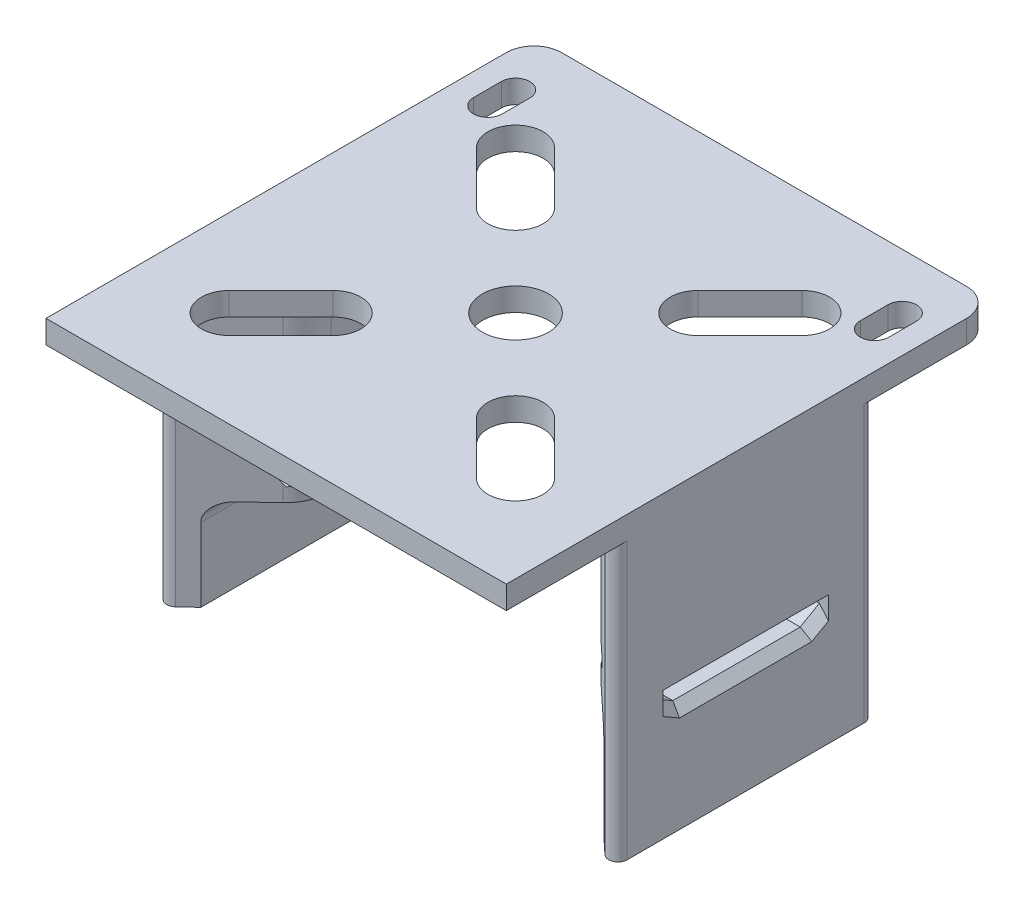
from build123d import *
from OCP.BRepFilletAPI import BRepFilletAPI_MakeChamfer

# Parameters (mm, degrees)
DODANIE_WYCI_GNI_CIE2_DEPTH = 2.5
SZKIC6_R                    = 3.6
WYTNIJ_WYCI_GNI_CIE3_DEPTH  = 37.881567212
DODANIE_WYCI_GNI_CIE3_DEPTH = 20
DODANIE_WYCI_GNI_CIE4_DEPTH = 10
ZAOKR_GLENIE1_R             = 1
ZAOKR_GLENIE2_R             = 5
WYTNIJ_WYCI_GNI_CIE1_REACH  = 59.319
SZKIC3_W                    = 18
SZKIC3_H                    = 2.5
SFAZOWANIE1_SIZE            = 1.2
SFAZOWANIE1_SIZE2           = 2.078460969
ZAOKR_GLENIE4_R             = 2
LUSTRO1_START               = -16
LUSTRO1_DEPTH               = 16
LUSTRO1_START_2             = -30
LUSTRO1_2_DEPTH             = 13.578460969
LUSTRO1_START_3             = -22
LUSTRO1_3_DEPTH             = 5.578460969
LUSTRO1_START_4             = -18.183542828
LUSTRO1_4_DEPTH             = 2.183542828
LUSTRO1_START_5             = -12.281593534
LUSTRO1_5_DEPTH             = 24.563187068
LUSTRO1_START_6             = -26
LUSTRO1_6_DEPTH             = 10.3
WYTNIJ_WYCI_GNI_CIE2_REACH  = 51.094
SFAZOWANIE2_SIZE            = 1
ZAOKR_GLENIE3_R             = 3


with BuildPart() as part:
    # Szkic1 → Dodanie-wyciągnięcie2 (new body)
    with BuildSketch(Plane(origin=(0, 0, 0), x_dir=(1, 0, 0), z_dir=(0, 1, 0))):
        Polygon((-25, -11), (-25, -26), (25, -26), (25, -11), (25, 27), (-25, 27), align=None)
    extrude(amount=DODANIE_WYCI_GNI_CIE2_DEPTH)

    # Szkic6 → Wytnij-wyciągnięcie3 (cut, through all)
    with BuildSketch(Plane(origin=(0, 2.5, 0), x_dir=(1, 0, 0), z_dir=(0, 1, 0))):
        with Locations(Location((0, 0, 0), (0, 0, 270))):
            Circle(SZKIC6_R)
        with BuildLine():
            Line((7.778174593, 12.02081528), (13.435028843, 17.67766953))
            ThreePointArc((13.435028843, 17.67766953), (17.67766953, 17.67766953), (17.67766953, 13.435028843))
            Line((17.67766953, 13.435028843), (12.02081528, 7.778174593))
            ThreePointArc((12.02081528, 7.778174593), (7.778174593, 7.778174593), (7.778174593, 12.02081528))
        make_face()
        with BuildLine():
            Line((12.02081528, -7.778174593), (17.67766953, -13.435028843))
            ThreePointArc((17.67766953, -13.435028843), (17.67766953, -17.67766953), (13.435028843, -17.67766953))
            Line((13.435028843, -17.67766953), (7.778174593, -12.02081528))
            ThreePointArc((7.778174593, -12.02081528), (7.778174593, -7.778174593), (12.02081528, -7.778174593))
        make_face()
        with BuildLine():
            Line((-7.778174593, -12.02081528), (-13.435028843, -17.67766953))
            ThreePointArc((-13.435028843, -17.67766953), (-17.67766953, -17.67766953), (-17.67766953, -13.435028843))
            Line((-17.67766953, -13.435028843), (-12.02081528, -7.778174593))
            ThreePointArc((-12.02081528, -7.778174593), (-7.778174593, -7.778174593), (-7.778174593, -12.02081528))
        make_face()
        with BuildLine():
            Line((-12.02081528, 7.778174593), (-17.67766953, 13.435028843))
            ThreePointArc((-17.67766953, 13.435028843), (-17.67766953, 17.67766953), (-13.435028843, 17.67766953))
            Line((-13.435028843, 17.67766953), (-7.778174593, 12.02081528))
            ThreePointArc((-7.778174593, 12.02081528), (-7.778174593, 7.778174593), (-12.02081528, 7.778174593))
        make_face()
    extrude(amount=-WYTNIJ_WYCI_GNI_CIE3_DEPTH, mode=Mode.SUBTRACT)

    # Szkic2 → Dodanie-wyciągnięcie3 (add)
    with BuildSketch(Plane.XZ):
        Polygon((15.7, -6.5), (15.7, 6.5), (25, 15.172390301), (25, -15.172390301), align=None)
    extrude(amount=DODANIE_WYCI_GNI_CIE3_DEPTH)

    # Szkic8 → Dodanie-wyciągnięcie4 (add)
    with BuildSketch(Plane.XZ.offset(20)):
        Polygon((25, 15.172390301), (25, -15.172390301), (21.9, -12.281593534), (21.9, 12.281593534), align=None)
    extrude(amount=DODANIE_WYCI_GNI_CIE4_DEPTH)

    # Zaokrąglenie1
    zaokr_glenie1_edges = [part.edges().sort_by_distance(p)[0] for p in [
        (25, -15, 15.172390301),
        (25, -15, -15.172390301),
    ]]
    fillet(zaokr_glenie1_edges, radius=ZAOKR_GLENIE1_R)

    # Zaokrąglenie2
    zaokr_glenie2_edges = [part.edges().sort_by_distance(p)[0] for p in [
        (15.7, -10, 6.5),
        (15.7, -10, -6.5),
    ]]
    fillet(zaokr_glenie2_edges, radius=ZAOKR_GLENIE2_R)

    # Szkic3 → Wytnij-wyciągnięcie1 (cut, up to next)
    with BuildSketch(Plane.ZY.offset(-15.7), mode=Mode.PRIVATE) as wytnij_wyci_gni_cie1_sk1:
        with Locations((0, -17.25)):
            Rectangle(SZKIC3_W, SZKIC3_H)
    wytnij_wyci_gni_cie1_tool1 = extrude(wytnij_wyci_gni_cie1_sk1.sketch, amount=-WYTNIJ_WYCI_GNI_CIE1_REACH, mode=Mode.PRIVATE) & part.part
    add(wytnij_wyci_gni_cie1_tool1.solids().sort_by_distance((15.7, -17.25, 0))[0], mode=Mode.SUBTRACT)

    # Sfazowanie1: one chamfer whose edges measure the first distance from different faces: ONE call of the kernel's chamfer builder (chamfer() names one face for all edges)
    sfazowanie1_edges_1 = [part.edges().sort_by_distance(p)[0] for p in [
        (21.690460888, -18.5, -9),
    ]]
    sfazowanie1_side_1 = [part.faces().sort_by_distance(p)[0] for p in [
        (21.690460888, -17.25, -9),
    ]]
    sfazowanie1_edges_2 = [part.edges().sort_by_distance(p)[0] for p in [
        (21.690460888, -18.5, 9),
    ]]
    sfazowanie1_side_2 = [part.faces().sort_by_distance(p)[0] for p in [
        (21.690460888, -17.25, 9),
    ]]
    sfazowanie1 = BRepFilletAPI_MakeChamfer(part.part.solid().wrapped)
    for e in sfazowanie1_edges_1:
        sfazowanie1.Add(SFAZOWANIE1_SIZE, SFAZOWANIE1_SIZE2, e.wrapped, sfazowanie1_side_1[0].wrapped)  # the first distance lies on this face
    for e in sfazowanie1_edges_2:
        sfazowanie1.Add(SFAZOWANIE1_SIZE, SFAZOWANIE1_SIZE2, e.wrapped, sfazowanie1_side_2[0].wrapped)  # the first distance lies on this face
    add(Compound.cast(sfazowanie1.Shape()), mode=Mode.REPLACE)

    # Zaokrąglenie4
    zaokr_glenie4_edges = [part.edges().sort_by_distance(p)[0] for p in [
        (21.9, -20, 0),
    ]]
    fillet(zaokr_glenie4_edges, radius=ZAOKR_GLENIE4_R)

    # Lustro1: read off the stored shape, not the designer's step
    # Lustro1 outline → Lustro1 (add)
    with BuildSketch(Plane(origin=(0, 0, 0), x_dir=(1, 0, 0), z_dir=(0, 1, 0)).offset(LUSTRO1_START)):
        with BuildLine():
            ThreePointArc((-25, -12.872547754), (-24.398749069, -13.789607828), (-23.31800164, -13.603901455))
            Line((-23.31800164, -13.603901455), (-17.2900082, -7.982706633))
            ThreePointArc((-17.2900082, -7.982706633), (-16.114699628, -6.31968347), (-15.7, -4.325938125))
            Line((-15.7, -4.325938125), (-15.7, 4.325938125))
            ThreePointArc((-15.7, 4.325938125), (-16.114699628, 6.31968347), (-17.2900082, 7.982706633))
            Line((-17.2900082, 7.982706633), (-23.31800164, 13.603901455))
            ThreePointArc((-23.31800164, 13.603901455), (-24.398749069, 13.789607828), (-25, 12.872547754))
            Line((-25, 12.872547754), (-25, -12.872547754))
        make_face()
    extrude(amount=LUSTRO1_DEPTH)



with BuildPart() as body_2:
    # Lustro1 2 outline → Lustro1 2 (new body)
    with BuildSketch(Plane(origin=(0, 0, 0), x_dir=(1, 0, 0), z_dir=(0, 1, 0)).offset(LUSTRO1_START_2)):
        with BuildLine():
            ThreePointArc((-25, -12.872547754), (-24.398749069, -13.789607828), (-23.31800164, -13.603901455))
            Line((-23.31800164, -13.603901455), (-21.9, -12.281593534))
            Line((-21.9, -12.281593534), (-21.9, 12.281593534))
            Line((-21.9, 12.281593534), (-23.31800164, 13.603901455))
            ThreePointArc((-23.31800164, 13.603901455), (-24.398749069, 13.789607828), (-25, 12.872547754))
            Line((-25, 12.872547754), (-25, -12.872547754))
        make_face()
    extrude(amount=LUSTRO1_2_DEPTH)

    # Lustro1 3 outline → Lustro1 3 (add)
    with BuildSketch(Plane(origin=(0, 0, 0), x_dir=(1, 0, 0), z_dir=(0, 1, 0)).offset(LUSTRO1_START_3)):
        with BuildLine():
            Line((-21.9, -12.281593534), (-17.2900082, -7.982706633))
            ThreePointArc((-17.2900082, -7.982706633), (-16.114699628, -6.31968347), (-15.7, -4.325938125))
            Line((-15.7, -4.325938125), (-15.7, 4.325938125))
            ThreePointArc((-15.7, 4.325938125), (-16.114699628, 6.31968347), (-17.2900082, 7.982706633))
            Line((-17.2900082, 7.982706633), (-21.9, 12.281593534))
            Line((-21.9, 12.281593534), (-21.9, -12.281593534))
        make_face()
    extrude(amount=LUSTRO1_3_DEPTH)


with BuildPart() as part_1:
    add(part.part)

    add(body_2.part)  # Lustro1 4 merges body 2
    # Lustro1 4 outline → Lustro1 4 (add)
    with BuildSketch(Plane(origin=(0, 0, 0), x_dir=(1, 0, 0), z_dir=(0, 1, 0)).offset(LUSTRO1_START_4)):
        with BuildLine():
            Line((-25, -9), (-25, -12.872547754))
            ThreePointArc((-25, -12.872547754), (-24.398749069, -13.789607828), (-23.31800164, -13.603901455))
            Line((-23.31800164, -13.603901455), (-18.380921775, -9))
            Line((-18.380921775, -9), (-25, -9))
        make_face()
        with BuildLine():
            Line((-25, 12.872547754), (-25, 9))
            Line((-25, 9), (-18.380921775, 9))
            Line((-18.380921775, 9), (-23.31800164, 13.603901455))
            ThreePointArc((-23.31800164, 13.603901455), (-24.398749069, 13.789607828), (-25, 12.872547754))
        make_face()
    extrude(amount=LUSTRO1_4_DEPTH)

    # Lustro1 5 outline → Lustro1 5 (cut)
    with BuildSketch(Plane.XY.offset(LUSTRO1_START_5)):
        with BuildLine():
            Line((-15.7, -22), (-15.7, -20))
            Line((-15.7, -20), (-19.9, -20))
            ThreePointArc((-19.9, -20), (-21.314213562, -20.585786438), (-21.9, -22))
            Line((-21.9, -22), (-15.7, -22))
        make_face()
    extrude(amount=LUSTRO1_5_DEPTH, mode=Mode.SUBTRACT)

    # Lustro1 6 outline → Lustro1 6 (cut)
    with BuildSketch(Plane.YZ.offset(LUSTRO1_START_6)):
        Polygon((-18.5, 7.8), (-18.5, -7.8), (-16.421539031, -9), (-16.421539031, 9), align=None)
    extrude(amount=LUSTRO1_6_DEPTH, mode=Mode.SUBTRACT)

    # Szkic5 → Wytnij-wyciągnięcie2 (cut, up to next)
    with BuildSketch(Plane(origin=(0, 2.5, 0), x_dir=(1, 0, 0), z_dir=(0, 1, 0)), mode=Mode.PRIVATE) as wytnij_wyci_gni_cie2_sk1:
        with BuildLine():
            Line((22.55, 21), (22.55, 18))
            ThreePointArc((22.55, 18), (21, 16.45), (19.45, 18))
            Line((19.45, 18), (19.45, 21))
            ThreePointArc((19.45, 21), (21, 22.55), (22.55, 21))
        make_face()
    wytnij_wyci_gni_cie2_tool1 = extrude(wytnij_wyci_gni_cie2_sk1.sketch, amount=-WYTNIJ_WYCI_GNI_CIE2_REACH, mode=Mode.PRIVATE) & part_1.part
    wytnij_wyci_gni_cie2 = wytnij_wyci_gni_cie2_tool1.solids().sort_by_distance((21, 2.5, -19.5))[0]
    add(wytnij_wyci_gni_cie2, mode=Mode.SUBTRACT)

    # Lustro2: Wytnij-wyciągnięcie2 across plane
    add(wytnij_wyci_gni_cie2.mirror(Plane(origin=(0, 0, 0), x_dir=(0, 0, 1), z_dir=(1, 0, 0))), mode=Mode.SUBTRACT)

    # Sfazowanie2
    sfazowanie2_edges = [part_1.edges().sort_by_distance(p)[0] for p in [
        (25, -18.5, 0),
        (25, -17.9, -7.960769515),
        (25, -17.9, 7.960769515),
        (-25, -18.5, 0),
        (-25, -17.460769515, -8.4),
        (-25, -17.460769515, 8.4),
    ]]
    chamfer(sfazowanie2_edges, length=SFAZOWANIE2_SIZE)

    # Zaokrąglenie3
    zaokr_glenie3_edges = [part_1.edges().sort_by_distance(p)[0] for p in [
        (-25, 1.25, -27),
        (25, 1.25, -27),
    ]]
    fillet(zaokr_glenie3_edges, radius=ZAOKR_GLENIE3_R)


solid = part_1.part
